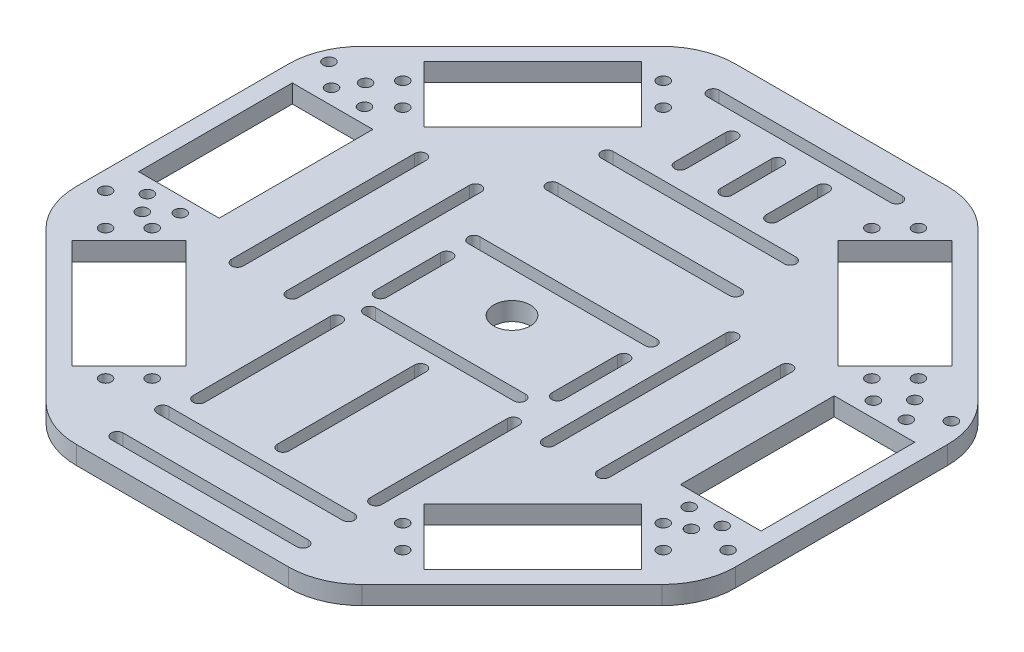
from build123d import *

# Parameters (mm, degrees)
BASEPLATE_DEPTH            = 5
FILLET1_R                  = 20
SKETCH2_W                  = 22
SKETCH2_H                  = 42
SKETCH2_R                  = 1.6
SERVO_HOLE_DEPTH           = 128.377392029
SKETCH3_R                  = 5
CENTER_HOLE_DEPTH          = 128.377392029
SERVO_HOLE_PATTERN_COUNT   = 8
SKETCH4_R                  = 1.6
ARDUINO_SCREW_HOLES_DEPTH  = 128.377392029
MIRROR1_COPY_1_SKETCH_W    = 22
MIRROR1_COPY_1_SKETCH_H    = 42
MIRROR1_COPY_1_SKETCH_R    = 1.6
MIRROR1_COPY_1_DEPTH       = 128.377392029
MIRROR1_COPY_2_SKETCH_W    = 22
MIRROR1_COPY_2_SKETCH_H    = 42
MIRROR1_COPY_2_SKETCH_R    = 1.6
MIRROR1_COPY_2_DEPTH       = 128.377392029
SLITS_DEPTH                = 128.377392029
SKETCH6_R                  = 1.6
EXTERIOR_SCREW_HOLES_DEPTH = 128.377392029
SKETCH7_R                  = 1.6
CUT_EXTRUDE1_DEPTH         = 128.377392029
CUT_EXTRUDE2_DEPTH         = 128.377392029


with BuildPart() as part:
    # Sketch1 → Baseplate (new body)
    with BuildSketch(Plane(origin=(0, 0, 0), x_dir=(1, 0, 0), z_dir=(0, 1, 0))):
        Polygon((-90, 37.279220614), (-90, -37.279220614), (-37.279220614, -90), (37.279220614, -90), (90, -37.279220614), (90, 37.279220614), (37.279220614, 90), (-37.279220614, 90), align=None)
    extrude(amount=BASEPLATE_DEPTH)

    # Fillet1
    fillet1_edges = [part.edges().sort_by_distance(p)[0] for p in [
        (-90, 2.5, -37.279220614),
        (-37.279220614, 2.5, -90),
        (37.279220614, 2.5, -90),
        (90, 2.5, -37.279220614),
        (90, 2.5, 37.279220614),
        (37.279220614, 2.5, 90),
        (-37.279220614, 2.5, 90),
        (-90, 2.5, 37.279220614),
    ]]
    fillet(fillet1_edges, radius=FILLET1_R)

    # Sketch2 → Servo hole (cut, through all)
    with BuildSketch(Plane(origin=(0, 5, 0), x_dir=(1, 0, 0), z_dir=(0, 1, 0))):
        with Locations((74, 4.005050634)):
            Rectangle(SKETCH2_W, SKETCH2_H)
        with Locations((78.5, 29.205050634)):
            Circle(SKETCH2_R)
        with Locations((69.5, 29.205050634)):
            Circle(SKETCH2_R)
        with Locations((69.5, -21.094949366)):
            Circle(SKETCH2_R)
        with Locations((78.5, -21.094949366)):
            Circle(SKETCH2_R)
    servo_hole = extrude(amount=-SERVO_HOLE_DEPTH, mode=Mode.SUBTRACT)

    # Sketch3 → Center hole (cut, through all)
    with BuildSketch(Plane(origin=(0, 5, 0), x_dir=(1, 0, 0), z_dir=(0, 1, 0))):
        Circle(SKETCH3_R)
    extrude(amount=-CENTER_HOLE_DEPTH, mode=Mode.SUBTRACT)

    # Servo hole pattern: Servo hole ×8 about axis, 5 skipped
    servo_hole_pattern_axis = Axis((0, 5, 0), (0, 1, 0))
    add([servo_hole.rotate(servo_hole_pattern_axis, i * 360 / SERVO_HOLE_PATTERN_COUNT) for i in range(1, SERVO_HOLE_PATTERN_COUNT) if i not in (2, 3, 4, 5, 6)], mode=Mode.SUBTRACT)

    # Sketch4 → Arduino Screw holes (cut, through all)
    with BuildSketch(Plane(origin=(0, 5, 0), x_dir=(1, 0, 0), z_dir=(0, 1, 0))):
        with Locations((-23, 5.1332)):
            Circle(SKETCH4_R)
        with Locations((-23, -70)):
            Circle(SKETCH4_R)
        with Locations((25.3362, 12.6262)):
            Circle(SKETCH4_R)
        with Locations((25.3362, -70)):
            Circle(SKETCH4_R)
        with Locations((-7.55849277, -18.3745)):
            Circle(SKETCH4_R)
        with Locations((20.45770723, -18.3745)):
            Circle(SKETCH4_R)
    extrude(amount=-ARDUINO_SCREW_HOLES_DEPTH, mode=Mode.SUBTRACT)

    # Mirror1: Servo hole across plane
    add(servo_hole.mirror(Plane(origin=(0, 0, 0), x_dir=(0, 0, 1), z_dir=(1, 0, 0))), mode=Mode.SUBTRACT)

    # Mirror1 copy 1 sketch → Mirror1 copy 1 (cut, through all)
    with BuildSketch(Plane(origin=(0, 5, 0), x_dir=(-0.7071067811865476, 0, -0.7071067811865475), z_dir=(0, 1, 0))):
        with Locations((74, -4.005050634)):
            Rectangle(MIRROR1_COPY_1_SKETCH_W, MIRROR1_COPY_1_SKETCH_H)
        with Locations((78.5, -29.205050634)):
            Circle(MIRROR1_COPY_1_SKETCH_R)
        with Locations((69.5, -29.205050634)):
            Circle(MIRROR1_COPY_1_SKETCH_R)
        with Locations((69.5, 21.094949366)):
            Circle(MIRROR1_COPY_1_SKETCH_R)
        with Locations((78.5, 21.094949366)):
            Circle(MIRROR1_COPY_1_SKETCH_R)
    extrude(amount=-MIRROR1_COPY_1_DEPTH, mode=Mode.SUBTRACT)

    # Mirror1 copy 2 sketch → Mirror1 copy 2 (cut, through all)
    with BuildSketch(Plane(origin=(0, 5, 0), x_dir=(-0.7071067811865474, 0, 0.7071067811865477), z_dir=(0, 1, 0))):
        with Locations((74, -4.005050634)):
            Rectangle(MIRROR1_COPY_2_SKETCH_W, MIRROR1_COPY_2_SKETCH_H)
        with Locations((78.5, -29.205050634)):
            Circle(MIRROR1_COPY_2_SKETCH_R)
        with Locations((69.5, -29.205050634)):
            Circle(MIRROR1_COPY_2_SKETCH_R)
        with Locations((69.5, 21.094949366)):
            Circle(MIRROR1_COPY_2_SKETCH_R)
        with Locations((78.5, 21.094949366)):
            Circle(MIRROR1_COPY_2_SKETCH_R)
    extrude(amount=-MIRROR1_COPY_2_DEPTH, mode=Mode.SUBTRACT)

    # Sketch5 → Slits (cut, through all)
    with BuildSketch(Plane(origin=(0, 5, 0), x_dir=(1, 0, 0), z_dir=(0, 1, 0))):
        with BuildLine():
            Line((25, 37.6), (-25, 37.6))
            ThreePointArc((-25, 37.6), (-26.6, 36), (-25, 34.4))
            Line((-25, 34.4), (25, 34.4))
            ThreePointArc((25, 34.4), (26.6, 36), (25, 37.6))
        make_face()
        with BuildLine():
            Line((25, 52.6), (-25, 52.6))
            ThreePointArc((-25, 52.6), (-26.6, 51), (-25, 49.4))
            Line((-25, 49.4), (25, 49.4))
            ThreePointArc((25, 49.4), (26.6, 51), (25, 52.6))
        make_face()
        with BuildLine():
            Line((-48.4, -25), (-48.4, 25))
            ThreePointArc((-48.4, 25), (-50, 26.6), (-51.6, 25))
            Line((-51.6, 25), (-51.6, -25))
            ThreePointArc((-51.6, -25), (-50, -26.6), (-48.4, -25))
        make_face()
        with BuildLine():
            Line((-33.4, -25), (-33.4, 25))
            ThreePointArc((-33.4, 25), (-35, 26.6), (-36.6, 25))
            Line((-36.6, 25), (-36.6, -25))
            ThreePointArc((-36.6, -25), (-35, -26.6), (-33.4, -25))
        make_face()
        with BuildLine():
            Line((36.6, -25), (36.6, 25))
            ThreePointArc((36.6, 25), (35, 26.6), (33.4, 25))
            Line((33.4, 25), (33.4, -25))
            ThreePointArc((33.4, -25), (35, -26.6), (36.6, -25))
        make_face()
        with BuildLine():
            Line((51.6, -25), (51.6, 25))
            ThreePointArc((51.6, 25), (50, 26.6), (48.4, 25))
            Line((48.4, 25), (48.4, -25))
            ThreePointArc((48.4, -25), (50, -26.6), (51.6, -25))
        make_face()
        with BuildLine():
            Line((25, 81.6), (-25, 81.6))
            ThreePointArc((-25, 81.6), (-26.6, 80), (-25, 78.4))
            Line((-25, 78.4), (25, 78.4))
            ThreePointArc((25, 78.4), (26.6, 80), (25, 81.6))
        make_face()
        with BuildLine():
            Line((-10.9, 58.5), (-10.9, 72.5))
            ThreePointArc((-10.9, 72.5), (-12.5, 74.1), (-14.1, 72.5))
            Line((-14.1, 72.5), (-14.1, 58.5))
            ThreePointArc((-14.1, 58.5), (-12.5, 56.9), (-10.9, 58.5))
        make_face()
        with BuildLine():
            Line((14.1, 58.5), (14.1, 72.5))
            ThreePointArc((14.1, 72.5), (12.5, 74.1), (10.9, 72.5))
            Line((10.9, 72.5), (10.9, 58.5))
            ThreePointArc((10.9, 58.5), (12.5, 56.9), (14.1, 58.5))
        make_face()
        with BuildLine():
            Line((1.6, 58.5), (1.6, 72.5))
            ThreePointArc((1.6, 72.5), (0, 74.1), (-1.6, 72.5))
            Line((-1.6, 72.5), (-1.6, 58.5))
            ThreePointArc((-1.6, 58.5), (0, 56.9), (1.6, 58.5))
        make_face()
    extrude(amount=-SLITS_DEPTH, mode=Mode.SUBTRACT)

    # Sketch6 → Exterior Screw Holes (cut, through all)
    with BuildSketch(Plane(origin=(0, 5, 0), x_dir=(1, 0, 0), z_dir=(0, 1, 0))):
        with Locations((-75, 35)):
            Circle(SKETCH6_R)
        with Locations((-85, 35)):
            Circle(SKETCH6_R)
    exterior_screw_holes = extrude(amount=-EXTERIOR_SCREW_HOLES_DEPTH, mode=Mode.SUBTRACT)

    # Mirror2: Exterior Screw Holes across plane
    add(exterior_screw_holes.mirror(Plane(origin=(0, 0, 0), x_dir=(0, 0, 1), z_dir=(1, 0, 0))), mode=Mode.SUBTRACT)

    # Sketch7 → Cut-Extrude1 (cut, through all)
    with BuildSketch(Plane(origin=(0, 5, 0), x_dir=(1, 0, 0), z_dir=(0, 1, 0))):
        with Locations((-85, -26)):
            Circle(SKETCH7_R)
        with Locations((-75, -26)):
            Circle(SKETCH7_R)
    cut_extrude1 = extrude(amount=-CUT_EXTRUDE1_DEPTH, mode=Mode.SUBTRACT)

    # Mirror3: Cut-Extrude1 across plane
    add(cut_extrude1.mirror(Plane(origin=(0, 0, 0), x_dir=(0, 0, 1), z_dir=(1, 0, 0))), mode=Mode.SUBTRACT)

    # Sketch8 → Cut-Extrude2 (cut, through all)
    with BuildSketch(Plane(origin=(0, 5, 0), x_dir=(1, 0, 0), z_dir=(0, 1, 0))):
        with BuildLine():
            Line((-20.45770723, -19.9745), (20.45770723, -19.9745))
            ThreePointArc((20.45770723, -19.9745), (22.05770723, -18.3745), (20.45770723, -16.7745))
            Line((20.45770723, -16.7745), (-20.45770723, -16.7745))
            ThreePointArc((-20.45770723, -16.7745), (-22.05770723, -18.3745), (-20.45770723, -19.9745))
        make_face()
        with BuildLine():
            Line((-23, 11.0262), (25.3362, 11.0262))
            ThreePointArc((25.3362, 11.0262), (26.9362, 12.6262), (25.3362, 14.2262))
            Line((25.3362, 14.2262), (-23, 14.2262))
            ThreePointArc((-23, 14.2262), (-24.6, 12.6262), (-23, 11.0262))
        make_face()
        with BuildLine():
            Line((-24.6, 5.1332), (-24.6, -12.8668))
            ThreePointArc((-24.6, -12.8668), (-23, -14.4668), (-21.4, -12.8668))
            Line((-21.4, -12.8668), (-21.4, 5.1332))
            ThreePointArc((-21.4, 5.1332), (-23, 6.7332), (-24.6, 5.1332))
        make_face()
        with BuildLine():
            Line((26.9362, -12.8668), (26.9362, 5.1332))
            ThreePointArc((26.9362, 5.1332), (25.3362, 6.7332), (23.7362, 5.1332))
            Line((23.7362, 5.1332), (23.7362, -12.8668))
            ThreePointArc((23.7362, -12.8668), (25.3362, -14.4668), (26.9362, -12.8668))
        make_face()
        with BuildLine():
            Line((25.3362, -68.4), (-25.3362, -68.4))
            ThreePointArc((-25.3362, -68.4), (-26.9362, -70), (-25.3362, -71.6))
            Line((-25.3362, -71.6), (25.3362, -71.6))
            ThreePointArc((25.3362, -71.6), (26.9362, -70), (25.3362, -68.4))
        make_face()
        with BuildLine():
            Line((-21.4, -62.5), (-21.4, -25))
            ThreePointArc((-21.4, -25), (-23, -23.4), (-24.6, -25))
            Line((-24.6, -25), (-24.6, -62.5))
            ThreePointArc((-24.6, -62.5), (-23, -64.1), (-21.4, -62.5))
        make_face()
        with BuildLine():
            Line((23.7362, -25), (23.7362, -62.5))
            ThreePointArc((23.7362, -62.5), (25.3362, -64.1), (26.9362, -62.5))
            Line((26.9362, -62.5), (26.9362, -25))
            ThreePointArc((26.9362, -25), (25.3362, -23.4), (23.7362, -25))
        make_face()
        with BuildLine():
            Line((-1.6, -25), (-1.6, -62.5))
            ThreePointArc((-1.6, -62.5), (0, -64.1), (1.6, -62.5))
            Line((1.6, -62.5), (1.6, -25))
            ThreePointArc((1.6, -25), (0, -23.4), (-1.6, -25))
        make_face()
        with BuildLine():
            Line((25.3362, -80.9), (-25.3362, -80.9))
            ThreePointArc((-25.3362, -80.9), (-26.9362, -82.5), (-25.3362, -84.1))
            Line((-25.3362, -84.1), (25.3362, -84.1))
            ThreePointArc((25.3362, -84.1), (26.9362, -82.5), (25.3362, -80.9))
        make_face()
    extrude(amount=-CUT_EXTRUDE2_DEPTH, mode=Mode.SUBTRACT)


solid = part.part
